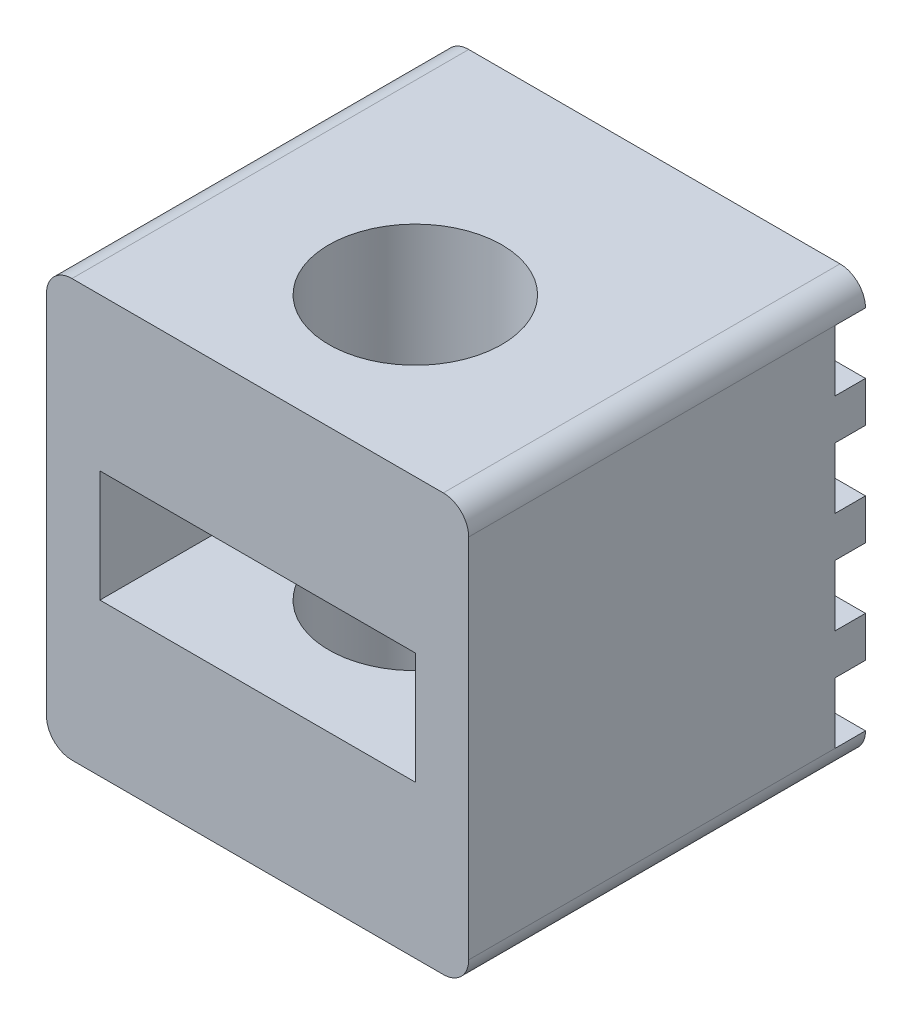
from build123d import *

# Parameters (mm, degrees)
SKETCH1_W           = 8.3
SKETCH1_H           = 7.8
BOSS_EXTRUDE1_DEPTH = 4.1
CUT_EXTRUDE1_DEPTH  = 11.045396956
SKETCH4_W           = 6.2
SKETCH4_H           = 2.2
CUT_EXTRUDE2_DEPTH  = 6.2
SKETCH5_R           = 1.7
CUT_EXTRUDE3_DEPTH  = 10.983611571
FILLET1_R           = 0.5


with BuildPart() as part:
    # Sketch1 → Boss-Extrude1 (new, symmetric)
    with BuildSketch(Plane(origin=(0, 0, 0), x_dir=(1, 0, 0), z_dir=(0, 1, 0))):
        Rectangle(SKETCH1_W, SKETCH1_H)
    extrude(amount=BOSS_EXTRUDE1_DEPTH, both=True)

    # Sketch2 → Cut-Extrude1 (cut, through all)
    with BuildSketch(Plane.ZY.offset(4.15)):
        Polygon((-8.9, 3.6), (-3.3, 3.6), (-3.3, 2.4), (-3.9, 2.4), (-3.9, 1.6), (-3.3, 1.6), (-3.3, 0.4), (-3.9, 0.4), (-3.9, -0.4), (-3.3, -0.4), (-3.3, -1.6), (-3.9, -1.6), (-3.9, -2.4), (-3.3, -2.4), (-3.3, -3.6), (-8.9, -3.6), align=None)
    extrude(amount=-CUT_EXTRUDE1_DEPTH, mode=Mode.SUBTRACT)

    # Sketch4 → Cut-Extrude2 (cut)
    with BuildSketch(Plane.XY.offset(3.9)):
        Rectangle(SKETCH4_W, SKETCH4_H)
    extrude(amount=-CUT_EXTRUDE2_DEPTH, mode=Mode.SUBTRACT)

    # Sketch5 → Cut-Extrude3 (cut, through all)
    with BuildSketch(Plane.XZ.offset(4.1)):
        with Locations(Location((0, 0.8, 0), (0, 0, 270))):
            Circle(SKETCH5_R)
    extrude(amount=-CUT_EXTRUDE3_DEPTH, mode=Mode.SUBTRACT)

    # Fillet1
    fillet1_edges = [part.edges().sort_by_distance(p)[0] for p in [
        (4.15, 4.1, 0),
        (4.15, -4.1, 0),
        (-4.15, 4.1, 0),
        (-4.15, -4.1, 0),
    ]]
    fillet(fillet1_edges, radius=FILLET1_R - 0.0001)  # a hair under: the kernel refuses the full size


solid = part.part
